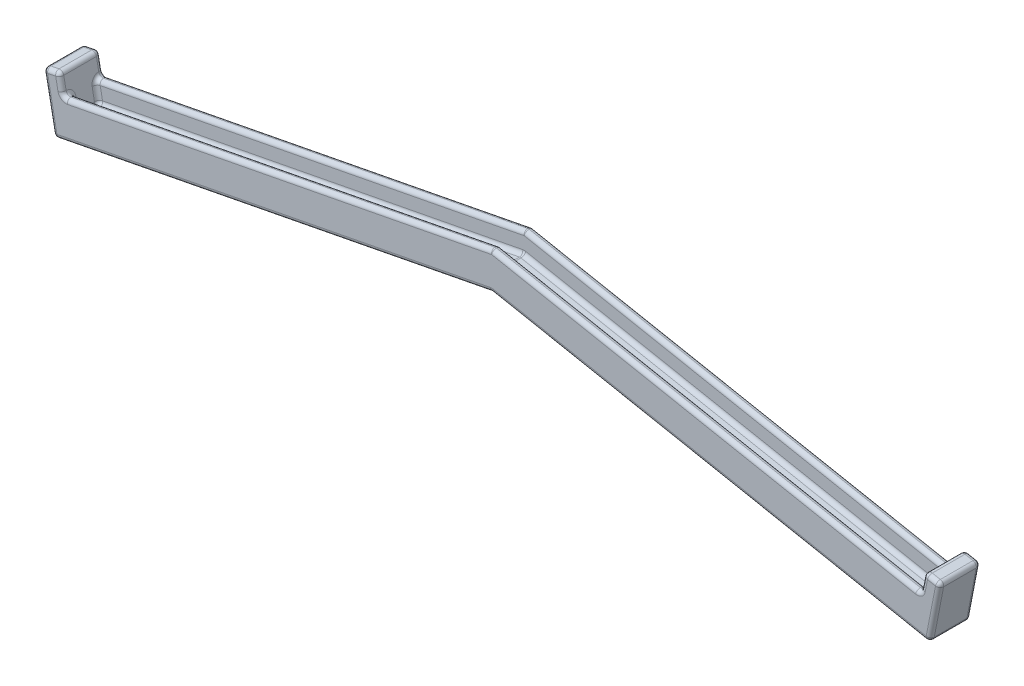
from build123d import *

# Parameters (mm, degrees)
DODANIE_WYCI_GNI_CIE1_DEPTH = 50
DODANIE_WYCI_GNI_CIE4_DEPTH = 10
DODANIE_WYCI_GNI_CIE5_DEPTH = 10
ZAOKR_GLENIE1_R             = 5


with BuildPart() as part:
    # Szkic1 → Dodanie-wyciągnięcie1 (new body)
    with BuildSketch(Plane.XY):
        Polygon((1060.363636364, 3.796475094), (540, 104.403065089), (19.636363636, 3.796475094), (10.145175901, 52.887384185), (-9.491187735, 49.090909091), (0, 0), (3.796475094, -19.636363636), (540, 84.403065089), (1076.203524906, -19.636363636), (1080, 0), (1089.491187735, 49.090909091), (1069.854824099, 52.887384185), align=None)
    extrude(amount=DODANIE_WYCI_GNI_CIE1_DEPTH)

    # Szkic4 → Dodanie-wyciągnięcie4 (add)
    with BuildSketch(Plane.XY.offset(50)):
        Polygon((19.636363636, 3.796475094), (14.890769769, 28.34192964), (540, 129.866028052), (1065.109230231, 28.34192964), (1060.363636364, 3.796475094), (540, 104.403065089), align=None)
    extrude(amount=-DODANIE_WYCI_GNI_CIE4_DEPTH)

    # Szkic5 → Dodanie-wyciągnięcie5 (add)
    with BuildSketch(Plane(origin=(0, 0, 0), x_dir=(-1, 0, 0), z_dir=(0, 0, -1))):
        Polygon((-1060.363636364, 3.796475094), (-1065.109230231, 28.34192964), (-540, 129.866028052), (-14.890769769, 28.34192964), (-19.636363636, 3.796475094), (-540, 104.403065089), align=None)
    extrude(amount=-DODANIE_WYCI_GNI_CIE5_DEPTH)

    # Zaokrąglenie1
    zaokr_glenie1_edges = [part.edges().sort_by_distance(p)[0] for p in [
        (271.898237547, 32.383350726, 50),
        (1082.847356321, 14.727272727, 0),
        (1079.673005917, 50.989146638, 0),
        (1067.482027165, 40.614656912, 0),
        (12.517972835, 40.614656912, 0),
        (-2.847356321, 14.727272727, 50),
        (0.326994083, 50.989146638, 0),
        (-2.847356321, 14.727272727, 0),
        (271.898237547, 32.383350726, 0),
        (808.101762453, 32.383350726, 0),
        (0.326994083, 50.989146638, 50),
        (1089.491187735, 49.090909091, 25),
        (1069.854824099, 52.887384185, 25),
        (10.145175901, 52.887384185, 25),
        (-9.491187735, 49.090909091, 25),
        (3.796475094, -19.636363636, 25),
        (540, 84.403065089, 25),
        (1076.203524906, -19.636363636, 25),
        (12.517972835, 40.614656912, 50),
        (1067.482027165, 40.614656912, 50),
        (1079.673005917, 50.989146638, 50),
        (19.636363636, 3.796475094, 25),
        (540, 104.403065089, 25),
        (1060.363636364, 3.796475094, 25),
        (279.818181818, 54.099770092, 40),
        (17.263566703, 16.069202367, 40),
        (1082.847356321, 14.727272727, 50),
        (277.445384884, 79.103978846, 40),
        (14.890769769, 28.34192964, 45),
        (802.554615116, 79.103978846, 40),
        (540, 129.866028052, 45),
        (1062.736433297, 16.069202367, 40),
        (1065.109230231, 28.34192964, 45),
        (800.181818182, 54.099770092, 40),
        (802.554615116, 79.103978846, 50),
        (277.445384884, 79.103978846, 50),
        (800.181818182, 54.099770092, 10),
        (1062.736433297, 16.069202367, 10),
        (802.554615116, 79.103978846, 10),
        (1065.109230231, 28.34192964, 5),
        (277.445384884, 79.103978846, 10),
        (540, 129.866028052, 5),
        (17.263566703, 16.069202367, 10),
        (14.890769769, 28.34192964, 5),
        (279.818181818, 54.099770092, 10),
        (277.445384884, 79.103978846, 0),
        (802.554615116, 79.103978846, 0),
        (808.101762453, 32.383350726, 50),
    ]]
    fillet(zaokr_glenie1_edges, radius=ZAOKR_GLENIE1_R - 0.0001)  # a hair under: the kernel refuses the full size


solid = part.part
